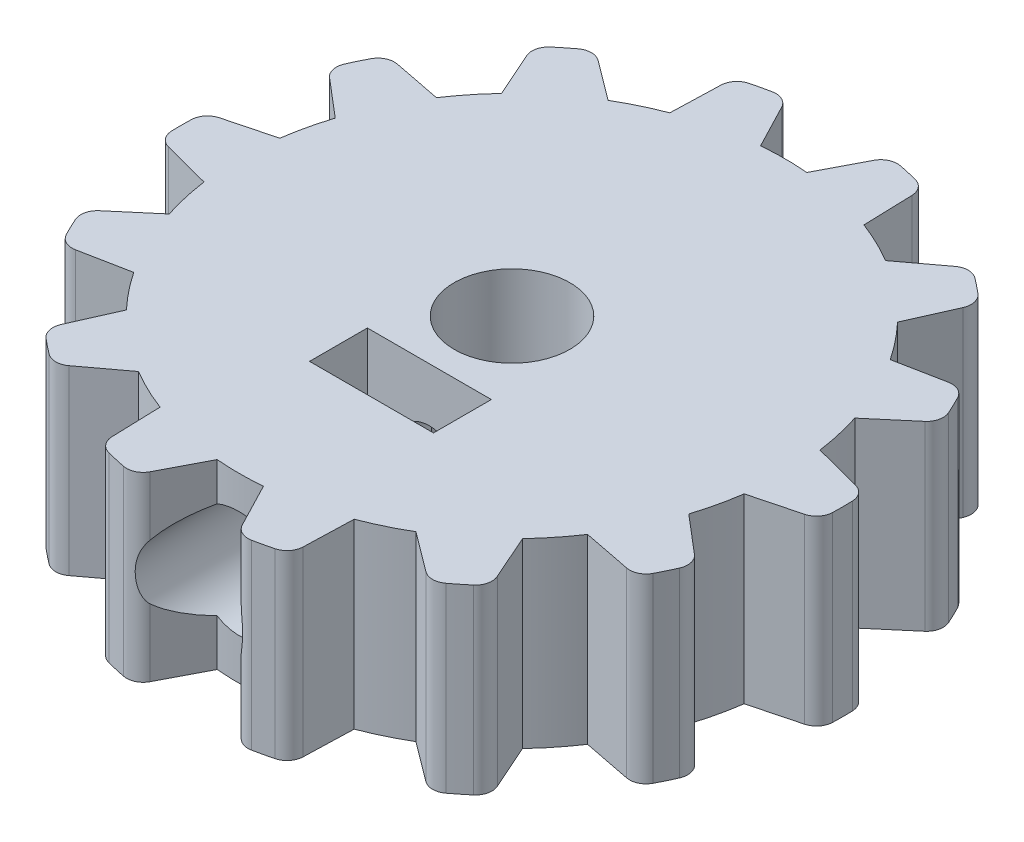
from build123d import *

# Parameters (mm, degrees)
SKETCH1_R                = 20
BOSS_EXTRUDE1_DEPTH      = 11
CUT_EXTRUDE1_REACH       = 32.348
FILLET1_R                = 1
CIRPATTERN1_COUNT        = 14
FILLET1_OF_CIRPATTERN1_R = 1
CUT_EXTRUDE2_REACH       = 32.113
SKETCH3_R                = 3.5
SKETCH4_W                = 7.5
SKETCH4_H                = 3.5
CUT_EXTRUDE3_DEPTH       = 9


with BuildPart() as part:
    # Sketch1 → Boss-Extrude1 (new body)
    with BuildSketch(Plane(origin=(0, 0, 0), x_dir=(1, 0, 0), z_dir=(0, 1, 0))):
        Circle(SKETCH1_R)
    extrude(amount=BOSS_EXTRUDE1_DEPTH)

    # Sketch2 → Cut-Extrude1 (cut, up to next)
    with BuildSketch(Plane(origin=(0, 11, 0), x_dir=(1, 0, 0), z_dir=(0, 1, 0)), mode=Mode.PRIVATE) as cut_extrude1_sk1:
        with BuildLine():
            Line((-3.125, 19.754350787), (-1.399921321, 16.440505476))
            ThreePointArc((-1.399921321, 16.440505476), (0, 16.5), (1.399921321, 16.440505476))
            Line((1.399921321, 16.440505476), (3.125, 19.754350787))
            ThreePointArc((3.125, 19.754350787), (0, 20), (-3.125, 19.754350787))
        make_face()
    cut_extrude1_tool1 = extrude(cut_extrude1_sk1.sketch, amount=-CUT_EXTRUDE1_REACH, mode=Mode.PRIVATE) & part.part
    cut_extrude1 = cut_extrude1_tool1.solids().sort_by_distance((0, 11, -18.420369))[0]
    add(cut_extrude1, mode=Mode.SUBTRACT)

    # Fillet1
    fillet1_edges = [part.edges().sort_by_distance(p)[0] for p in [
        (3.125, 5.5, -19.754350787),
        (-3.125, 5.5, -19.754350787),
    ]]
    fillet(fillet1_edges, radius=FILLET1_R)

    # CirPattern1: Cut-Extrude1 ×14 about axis
    cirpattern1_axis = Axis((0, 11, 0), (0, -1, 0))
    for i in range(1, CIRPATTERN1_COUNT):
        add(cut_extrude1.rotate(cirpattern1_axis, i * 360 / CIRPATTERN1_COUNT), mode=Mode.SUBTRACT)

    # Fillet1 of CirPattern1
    fillet1_of_cirpattern1_edges = [part.edges().sort_by_distance(p)[0] for p in [
        (11.386619295, 5.5, -16.44216838),
        (5.755563871, 5.5, -19.153941749),
        (17.392978991, 5.5, -9.873412875),
        (13.49616773, 5.5, -14.75985964),
        (19.954445887, 5.5, -1.349106861),
        (18.56369005, 5.5, -7.442406312),
        (18.56369005, 5.5, 7.442406312),
        (19.954445887, 5.5, 1.349106861),
        (13.49616773, 5.5, 14.75985964),
        (17.392978991, 5.5, 9.873412875),
        (5.755563871, 5.5, 19.153941749),
        (11.386619295, 5.5, 16.44216838),
        (-3.125, 5.5, 19.754350787),
        (3.125, 5.5, 19.754350787),
        (-11.386619295, 5.5, 16.44216838),
        (-5.755563871, 5.5, 19.153941749),
        (-17.392978991, 5.5, 9.873412875),
        (-13.49616773, 5.5, 14.75985964),
        (-19.954445887, 5.5, 1.349106861),
        (-18.56369005, 5.5, 7.442406312),
        (-18.56369005, 5.5, -7.442406312),
        (-19.954445887, 5.5, -1.349106861),
        (-13.49616773, 5.5, -14.75985964),
        (-17.392978991, 5.5, -9.873412875),
        (-5.755563871, 5.5, -19.153941749),
        (-11.386619295, 5.5, -16.44216838),
    ]]
    fillet(fillet1_of_cirpattern1_edges, radius=FILLET1_OF_CIRPATTERN1_R)

    # Sketch3 → Cut-Extrude2 (cut, up to next)
    with BuildSketch(Plane(origin=(0, 11, 0), x_dir=(1, 0, 0), z_dir=(0, 1, 0)), mode=Mode.PRIVATE) as cut_extrude2_sk1:
        Circle(SKETCH3_R)
    cut_extrude2_tool1 = extrude(cut_extrude2_sk1.sketch, amount=-CUT_EXTRUDE2_REACH, mode=Mode.PRIVATE) & part.part
    add(cut_extrude2_tool1.solids().sort_by_distance((0, 11, 0))[0], mode=Mode.SUBTRACT)

    # Sketch4 → Cut-Extrude3 (cut)
    with BuildSketch(Plane(origin=(0, 11, 0), x_dir=(1, 0, 0), z_dir=(0, 1, 0))):
        with Locations((0, -6.75)):
            Rectangle(SKETCH4_W, SKETCH4_H)
    extrude(amount=-CUT_EXTRUDE3_DEPTH, mode=Mode.SUBTRACT)

    # Sketch6 → Cut-Revolve1 (revolve, cut)
    with BuildSketch(Plane(origin=(0, 0, 0), x_dir=(0, 0, -1), z_dir=(1, 0, 0))):
        Polygon((0, 5.75), (0, 7.75), (-10, 7.75), (-10, 9), (-25, 9), (-25, 5.75), align=None)
    revolve(axis=Axis((0, 5.75, 0), (0, 0, 1)), mode=Mode.SUBTRACT)


solid = part.part
